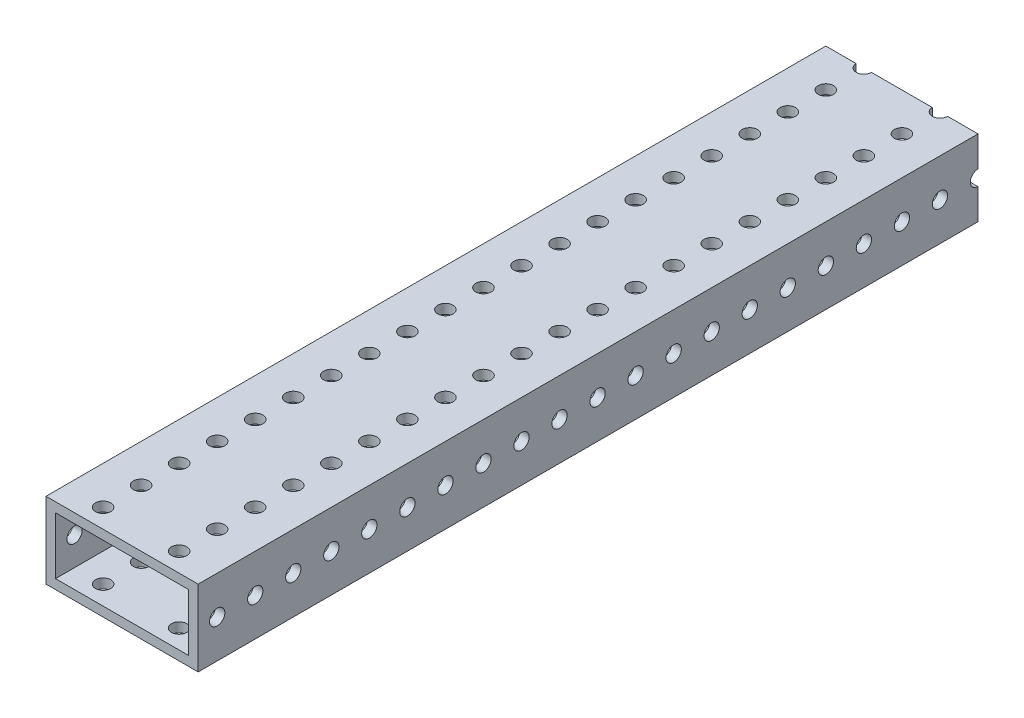
from build123d import *

# Parameters (mm, degrees)
SKETCH1_W           = 50.8
SKETCH1_H           = 25.4
SKETCH1_W_2         = 44.45
SKETCH1_H_2         = 19.05
BOSS_EXTRUDE1_DEPTH = 184.15
SKETCH6_R           = 2.5527
CUT_EXTRUDE5_DEPTH  = 192.450130582
SKETCH5_W           = 63.5
SKETCH5_H           = 25.4
CUT_EXTRUDE6_DEPTH  = 192.450130582
SKETCH2_R           = 2.5527
CUT_EXTRUDE1_DEPTH  = 188.620741124
SKETCH7_W           = 44.45
SKETCH7_H           = 25.4
CUT_EXTRUDE7_DEPTH  = 192.450130582


with BuildPart() as part:
    # Sketch1 → Boss-Extrude1 (new, symmetric)
    with BuildSketch(Plane.XY):
        Rectangle(SKETCH1_W, SKETCH1_H)
        Rectangle(SKETCH1_W_2, SKETCH1_H_2, mode=Mode.SUBTRACT)
    extrude(amount=BOSS_EXTRUDE1_DEPTH, both=True)

    # Sketch6 → Cut-Extrude5 (cut, through all)
    with BuildSketch(Plane(origin=(25.4, 0, 0), x_dir=(0, 0, -1), z_dir=(1, 0, 0))):
        with Locations((-177.8, 0)):
            Circle(SKETCH6_R)
        with Locations((-165.1, 0)):
            Circle(SKETCH6_R)
        with Locations((-152.4, 0)):
            Circle(SKETCH6_R)
        with Locations((-139.7, 0)):
            Circle(SKETCH6_R)
        with Locations((-127, 0)):
            Circle(SKETCH6_R)
        with Locations((-114.3, 0)):
            Circle(SKETCH6_R)
        with Locations((-101.6, 0)):
            Circle(SKETCH6_R)
        with Locations((-88.9, 0)):
            Circle(SKETCH6_R)
        with Locations((-76.2, 0)):
            Circle(SKETCH6_R)
        with Locations((-63.5, 0)):
            Circle(SKETCH6_R)
        with Locations((-50.8, 0)):
            Circle(SKETCH6_R)
        with Locations((-38.1, 0)):
            Circle(SKETCH6_R)
        with Locations((-25.4, 0)):
            Circle(SKETCH6_R)
        with Locations((-12.7, 0)):
            Circle(SKETCH6_R)
        Circle(SKETCH6_R)
        with Locations((12.7, 0)):
            Circle(SKETCH6_R)
        with Locations((25.4, 0)):
            Circle(SKETCH6_R)
        with Locations((38.1, 0)):
            Circle(SKETCH6_R)
        with Locations((50.8, 0)):
            Circle(SKETCH6_R)
        with Locations((63.5, 0)):
            Circle(SKETCH6_R)
        with Locations((76.2, 0)):
            Circle(SKETCH6_R)
        with Locations((88.9, 0)):
            Circle(SKETCH6_R)
        with Locations((101.6, 0)):
            Circle(SKETCH6_R)
        with Locations((114.3, 0)):
            Circle(SKETCH6_R)
    extrude(amount=-CUT_EXTRUDE5_DEPTH, mode=Mode.SUBTRACT)

    # Sketch5 → Cut-Extrude6 (cut, through all)
    with BuildSketch(Plane.ZY.offset(25.4)):
        with Locations((-152.4, 0)):
            Rectangle(SKETCH5_W, SKETCH5_H)
    extrude(amount=-CUT_EXTRUDE6_DEPTH, mode=Mode.SUBTRACT)

    # Sketch2 → Cut-Extrude1 (cut, through all)
    with BuildSketch(Plane(origin=(0, 12.7, 0), x_dir=(1, 0, 0), z_dir=(0, 1, 0))):
        with Locations((12.7, -177.8)):
            Circle(SKETCH2_R)
        with Locations((-12.7, -177.8)):
            Circle(SKETCH2_R)
        with Locations((-12.7, -165.1)):
            Circle(SKETCH2_R)
        with Locations((-12.7, -152.4)):
            Circle(SKETCH2_R)
        with Locations((-12.7, -139.7)):
            Circle(SKETCH2_R)
        with Locations((-12.7, -127)):
            Circle(SKETCH2_R)
        with Locations((-12.7, -114.3)):
            Circle(SKETCH2_R)
        with Locations((-12.7, -101.6)):
            Circle(SKETCH2_R)
        with Locations((-12.7, -88.9)):
            Circle(SKETCH2_R)
        with Locations((-12.7, -76.2)):
            Circle(SKETCH2_R)
        with Locations((-12.7, -63.5)):
            Circle(SKETCH2_R)
        with Locations((-12.7, -50.8)):
            Circle(SKETCH2_R)
        with Locations((-12.7, -38.1)):
            Circle(SKETCH2_R)
        with Locations((-12.7, -25.4)):
            Circle(SKETCH2_R)
        with Locations((-12.7, -12.7)):
            Circle(SKETCH2_R)
        with Locations((-12.7, 0)):
            Circle(SKETCH2_R)
        with Locations((-12.7, 12.7)):
            Circle(SKETCH2_R)
        with Locations((-12.7, 25.4)):
            Circle(SKETCH2_R)
        with Locations((-12.7, 38.1)):
            Circle(SKETCH2_R)
        with Locations((-12.7, 50.8)):
            Circle(SKETCH2_R)
        with Locations((-12.7, 63.5)):
            Circle(SKETCH2_R)
        with Locations((-12.7, 76.2)):
            Circle(SKETCH2_R)
        with Locations((-12.7, 88.9)):
            Circle(SKETCH2_R)
        with Locations((-12.7, 101.6)):
            Circle(SKETCH2_R)
        with Locations((-12.7, 139.7)):
            Circle(SKETCH2_R)
        with Locations((-12.7, 152.4)):
            Circle(SKETCH2_R)
        with Locations((-12.7, 165.1)):
            Circle(SKETCH2_R)
        with Locations((-12.7, 190.5)):
            Circle(SKETCH2_R)
        with Locations((-12.7, 203.2)):
            Circle(SKETCH2_R)
        with Locations((-12.7, 215.9)):
            Circle(SKETCH2_R)
        with Locations((-12.7, 228.6)):
            Circle(SKETCH2_R)
        with Locations((-12.7, 241.3)):
            Circle(SKETCH2_R)
        with Locations((-12.7, 254)):
            Circle(SKETCH2_R)
        with Locations((-12.7, 266.7)):
            Circle(SKETCH2_R)
        with Locations((-12.7, 279.4)):
            Circle(SKETCH2_R)
        with Locations((-12.7, 292.1)):
            Circle(SKETCH2_R)
        with Locations((-12.7, 304.8)):
            Circle(SKETCH2_R)
        with Locations((-12.7, 317.5)):
            Circle(SKETCH2_R)
        with Locations((-12.7, 330.2)):
            Circle(SKETCH2_R)
        with Locations((-12.7, 342.9)):
            Circle(SKETCH2_R)
        with Locations((-12.7, 355.6)):
            Circle(SKETCH2_R)
        with Locations((-12.7, 368.3)):
            Circle(SKETCH2_R)
        with Locations((-12.7, 381)):
            Circle(SKETCH2_R)
        with Locations((-12.7, 393.7)):
            Circle(SKETCH2_R)
        with Locations((-12.7, 406.4)):
            Circle(SKETCH2_R)
        with Locations((12.7, -165.1)):
            Circle(SKETCH2_R)
        with Locations((12.7, -152.4)):
            Circle(SKETCH2_R)
        with Locations((12.7, -139.7)):
            Circle(SKETCH2_R)
        with Locations((12.7, -127)):
            Circle(SKETCH2_R)
        with Locations((12.7, -114.3)):
            Circle(SKETCH2_R)
        with Locations((12.7, -101.6)):
            Circle(SKETCH2_R)
        with Locations((12.7, -88.9)):
            Circle(SKETCH2_R)
        with Locations((12.7, -76.2)):
            Circle(SKETCH2_R)
        with Locations((12.7, -63.5)):
            Circle(SKETCH2_R)
        with Locations((12.7, -50.8)):
            Circle(SKETCH2_R)
        with Locations((12.7, -38.1)):
            Circle(SKETCH2_R)
        with Locations((12.7, -25.4)):
            Circle(SKETCH2_R)
        with Locations((12.7, -12.7)):
            Circle(SKETCH2_R)
        with Locations((12.7, 0)):
            Circle(SKETCH2_R)
        with Locations((12.7, 12.7)):
            Circle(SKETCH2_R)
        with Locations((12.7, 25.4)):
            Circle(SKETCH2_R)
        with Locations((12.7, 38.1)):
            Circle(SKETCH2_R)
        with Locations((12.7, 50.8)):
            Circle(SKETCH2_R)
        with Locations((12.7, 63.5)):
            Circle(SKETCH2_R)
        with Locations((12.7, 76.2)):
            Circle(SKETCH2_R)
        with Locations((12.7, 88.9)):
            Circle(SKETCH2_R)
        with Locations((12.7, 101.6)):
            Circle(SKETCH2_R)
        with Locations((12.7, 139.7)):
            Circle(SKETCH2_R)
        with Locations((12.7, 152.4)):
            Circle(SKETCH2_R)
        with Locations((12.7, 165.1)):
            Circle(SKETCH2_R)
        with Locations((12.7, 190.5)):
            Circle(SKETCH2_R)
        with Locations((12.7, 203.2)):
            Circle(SKETCH2_R)
        with Locations((12.7, 215.9)):
            Circle(SKETCH2_R)
        with Locations((12.7, 228.6)):
            Circle(SKETCH2_R)
        with Locations((12.7, 241.3)):
            Circle(SKETCH2_R)
        with Locations((12.7, 254)):
            Circle(SKETCH2_R)
        with Locations((12.7, 266.7)):
            Circle(SKETCH2_R)
        with Locations((12.7, 279.4)):
            Circle(SKETCH2_R)
        with Locations((12.7, 292.1)):
            Circle(SKETCH2_R)
        with Locations((12.7, 304.8)):
            Circle(SKETCH2_R)
        with Locations((12.7, 317.5)):
            Circle(SKETCH2_R)
        with Locations((12.7, 330.2)):
            Circle(SKETCH2_R)
        with Locations((12.7, 342.9)):
            Circle(SKETCH2_R)
        with Locations((12.7, 355.6)):
            Circle(SKETCH2_R)
        with Locations((12.7, 368.3)):
            Circle(SKETCH2_R)
        with Locations((12.7, 381)):
            Circle(SKETCH2_R)
        with Locations((12.7, 393.7)):
            Circle(SKETCH2_R)
        with Locations((12.7, 406.4)):
            Circle(SKETCH2_R)
        with Locations((12.7, 419.1)):
            Circle(SKETCH2_R)
        with Locations((12.7, 431.8)):
            Circle(SKETCH2_R)
        with Locations((12.7, 444.5)):
            Circle(SKETCH2_R)
    extrude(amount=-CUT_EXTRUDE1_DEPTH, mode=Mode.SUBTRACT)

    # Sketch7 → Cut-Extrude7 (cut, through all)
    with BuildSketch(Plane.ZY.offset(25.4)):
        with Locations((-98.425, 0)):
            Rectangle(SKETCH7_W, SKETCH7_H)
    extrude(amount=-CUT_EXTRUDE7_DEPTH, mode=Mode.SUBTRACT)


solid = part.part
